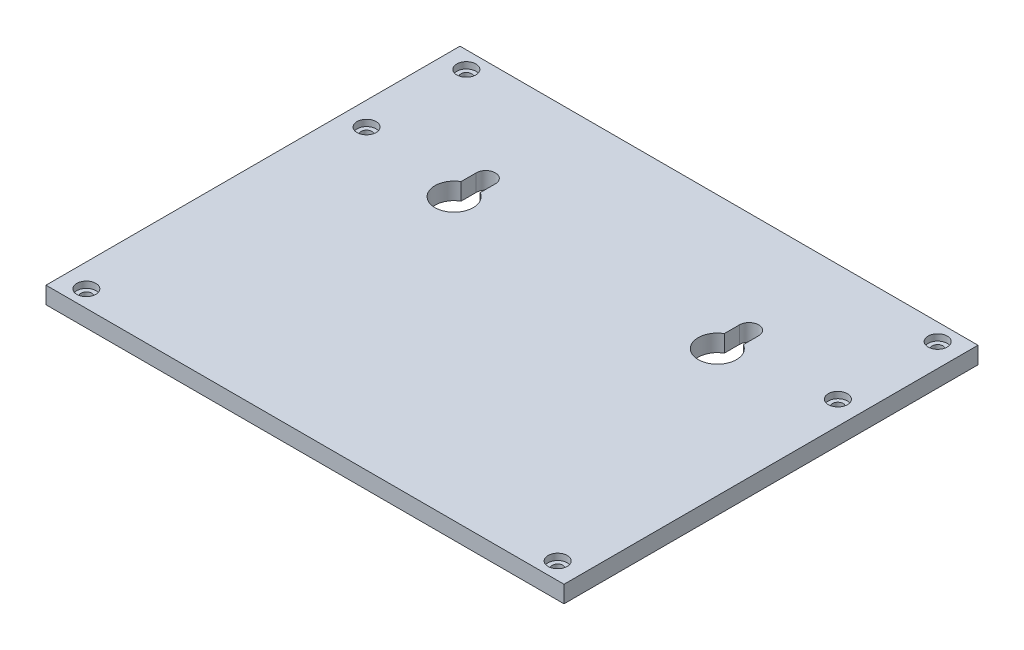
from build123d import *

# Parameters (mm, degrees)
SKETCH1_W           = 122
SKETCH1_H           = 97.5
BOSS_EXTRUDE1_DEPTH = 4
SKETCH2_R           = 1.25
CUT_EXTRUDE1_DEPTH  = 4
SKETCH3_R           = 2.25
CUT_EXTRUDE2_DEPTH  = 1.5
CUT_EXTRUDE3_DEPTH  = 4


with BuildPart() as part:
    # Sketch1 → Boss-Extrude1 (new body)
    with BuildSketch(Plane(origin=(0, 0, 0), x_dir=(1, 0, 0), z_dir=(0, 1, 0))):
        with Locations((-30.40625, -8.671875)):
            Rectangle(SKETCH1_W, SKETCH1_H)
    extrude(amount=BOSS_EXTRUDE1_DEPTH)

    # Sketch2 → Cut-Extrude1 (cut)
    with BuildSketch(Plane(origin=(0, 4, 0), x_dir=(1, 0, 0), z_dir=(0, 1, 0))):
        with Locations((-85.90625, -53.421875)):
            Circle(SKETCH2_R)
        with Locations((-85.90625, 12.578125)):
            Circle(SKETCH2_R)
        with Locations((25.09375, 12.578125)):
            Circle(SKETCH2_R)
        with Locations((25.09375, -53.421875)):
            Circle(SKETCH2_R)
        with Locations((-85.90625, 36.078125)):
            Circle(SKETCH2_R)
        with Locations((25.09375, 36.078125)):
            Circle(SKETCH2_R)
    extrude(amount=-CUT_EXTRUDE1_DEPTH, mode=Mode.SUBTRACT)

    # Sketch3 → Cut-Extrude2 (cut)
    with BuildSketch(Plane(origin=(0, 4, 0), x_dir=(1, 0, 0), z_dir=(0, 1, 0))):
        with Locations((-85.90625, 12.578125)):
            Circle(SKETCH3_R)
        with Locations((-85.90625, -53.421875)):
            Circle(SKETCH3_R)
        with Locations((25.09375, -53.421875)):
            Circle(SKETCH3_R)
        with Locations((25.09375, 12.578125)):
            Circle(SKETCH3_R)
        with Locations((-85.90625, 36.078125)):
            Circle(SKETCH3_R)
        with Locations((25.09375, 36.078125)):
            Circle(SKETCH3_R)
    extrude(amount=-CUT_EXTRUDE2_DEPTH, mode=Mode.SUBTRACT)

    # Sketch4 → Cut-Extrude3 (cut)
    with BuildSketch(Plane(origin=(0, 4, 0), x_dir=(1, 0, 0), z_dir=(0, 1, 0))):
        with BuildLine():
            Line((-1.65625, 16.157315761), (-1.65625, 12.586287383))
            ThreePointArc((-1.65625, 12.586287383), (0.59375, 4.18990801), (2.84375, 12.586287383))
            Line((2.84375, 12.586287383), (2.84375, 16.157315761))
            ThreePointArc((2.84375, 16.157315761), (0.59375, 18.407315761), (-1.65625, 16.157315761))
        make_face()
        with BuildLine():
            Line((-63.65625, 16.157315761), (-63.65625, 12.586287383))
            ThreePointArc((-63.65625, 12.586287383), (-61.40625, 4.18990801), (-59.15625, 12.586287383))
            Line((-59.15625, 12.586287383), (-59.15625, 16.157315761))
            ThreePointArc((-59.15625, 16.157315761), (-61.40625, 18.407315761), (-63.65625, 16.157315761))
        make_face()
    extrude(amount=-CUT_EXTRUDE3_DEPTH, mode=Mode.SUBTRACT)


solid = part.part
